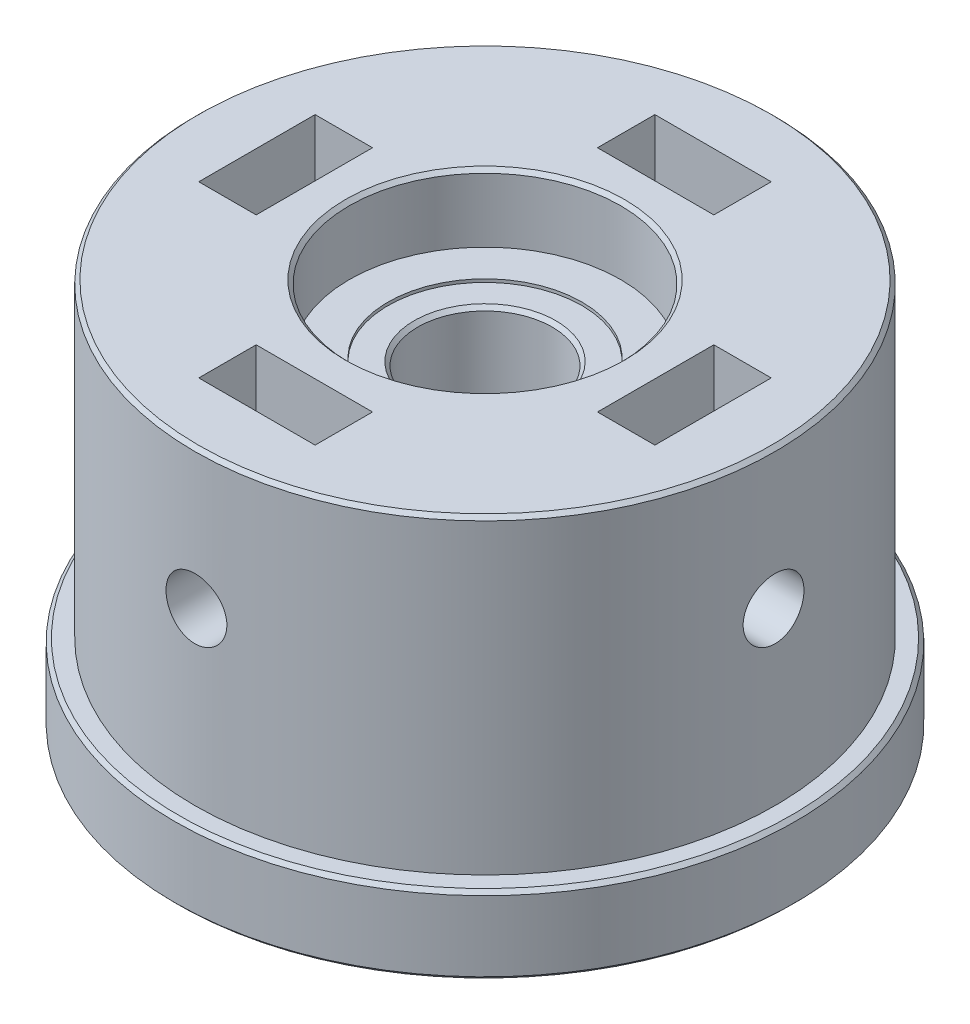
from build123d import *

# Parameters (mm, degrees)
SKETCH1_R           = 23.749
BOSS_EXTRUDE1_DEPTH = 25.4
SKETCH2_R           = 25.4
BOSS_EXTRUDE2_DEPTH = 6.35
SKETCH3_R           = 5.5
CUT_EXTRUDE1_DEPTH  = 48.941448664
SKETCH4_R           = 11.1125
CUT_EXTRUDE2_DEPTH  = 5.5372
SKETCH5_R           = 7.9375
CUT_EXTRUDE3_DEPTH  = 0.254
CHAMFER1_SIZE       = 0.299999908
SKETCH8_W           = 4.699
SKETCH8_H           = 9.525
SKETCH8_W_2         = 9.525
SKETCH8_H_2         = 4.699
CUT_EXTRUDE4_DEPTH  = 16.1925
SKETCH9_R           = 2.4892
CUT_EXTRUDE5_DEPTH  = 7.62
SKETCH10_R          = 2.4892
CUT_EXTRUDE6_DEPTH  = 7.62


with BuildPart() as part:
    # Sketch1 → Boss-Extrude1 (new body)
    with BuildSketch(Plane(origin=(0, 0, 0), x_dir=(1, 0, 0), z_dir=(0, 1, 0))):
        Circle(SKETCH1_R)
    extrude(amount=BOSS_EXTRUDE1_DEPTH)

    # Sketch2 → Boss-Extrude2 (add)
    with BuildSketch(Plane.XZ):
        Circle(SKETCH2_R)
    extrude(amount=BOSS_EXTRUDE2_DEPTH)

    # Sketch3 → Cut-Extrude1 (cut, through all)
    with BuildSketch(Plane.XZ.offset(6.35)):
        Circle(SKETCH3_R)
    extrude(amount=-CUT_EXTRUDE1_DEPTH, mode=Mode.SUBTRACT)

    # Sketch4 → Cut-Extrude2 (cut)
    with BuildSketch(Plane.XZ.offset(6.35)):
        Circle(SKETCH4_R)
    cut_extrude2 = extrude(amount=-CUT_EXTRUDE2_DEPTH, mode=Mode.SUBTRACT)

    # Sketch5 → Cut-Extrude3 (cut)
    with BuildSketch(Plane.XZ.offset(0.8128)):
        Circle(SKETCH5_R)
    cut_extrude3 = extrude(amount=-CUT_EXTRUDE3_DEPTH, mode=Mode.SUBTRACT)

    # Mirror1: Cut-Extrude2, Cut-Extrude3 across plane
    add(cut_extrude2.mirror(Plane.ZX.offset(9.525)), mode=Mode.SUBTRACT)
    add(cut_extrude3.mirror(Plane.ZX.offset(9.525)), mode=Mode.SUBTRACT)

    # Chamfer1
    chamfer1_edges = [part.edges().sort_by_distance(p)[0] for p in [
        (-25.4, 0, 0),
        (-25.4, -6.35, 0),
        (-11.1125, -6.35, 0),
        (-23.749, 25.4, 0),
        (-5.5, 19.6088, 0),
        (-5.5, -0.5588, 0),
        (-11.1125, 25.4, 0),
    ]]
    chamfer(chamfer1_edges, length=CHAMFER1_SIZE)

    # Sketch8 → Cut-Extrude4 (cut)
    with BuildSketch(Plane(origin=(0, 25.4, 0), x_dir=(1, 0, 0), z_dir=(0, 1, 0))):
        with Locations((16.3195, 0)):
            Rectangle(SKETCH8_W, SKETCH8_H)
        with Locations((0, 16.3195)):
            Rectangle(SKETCH8_W_2, SKETCH8_H_2)
        with Locations((0, -16.3195)):
            Rectangle(SKETCH8_W_2, SKETCH8_H_2)
        with Locations((-16.3195, 0)):
            Rectangle(SKETCH8_W, SKETCH8_H)
    extrude(amount=-CUT_EXTRUDE4_DEPTH, mode=Mode.SUBTRACT)

    # Sketch9 → Cut-Extrude5 (cut)
    with BuildSketch(Plane.XY.offset(25.4)):
        with Locations((0, 13.97)):
            Circle(SKETCH9_R)
    cut_extrude5 = extrude(amount=-CUT_EXTRUDE5_DEPTH, mode=Mode.SUBTRACT)

    # Sketch10 → Cut-Extrude6 (cut)
    with BuildSketch(Plane(origin=(25.4, 0, 0), x_dir=(0, 0, -1), z_dir=(1, 0, 0))):
        with Locations((0, 13.97)):
            Circle(SKETCH10_R)
    cut_extrude6 = extrude(amount=-CUT_EXTRUDE6_DEPTH, mode=Mode.SUBTRACT)

    # Mirror2: Cut-Extrude5 across plane
    add(cut_extrude5.mirror(Plane.XY), mode=Mode.SUBTRACT)

    # Mirror3: Cut-Extrude6 across plane
    add(cut_extrude6.mirror(Plane(origin=(0, 0, 0), x_dir=(0, 0, 1), z_dir=(1, 0, 0))), mode=Mode.SUBTRACT)


solid = part.part
